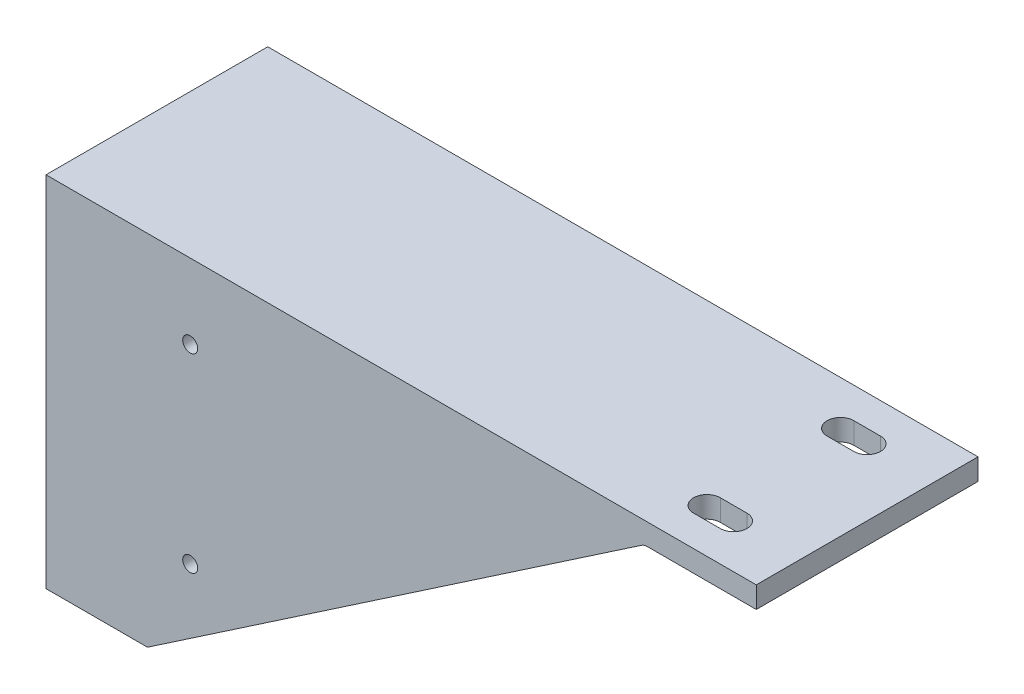
from build123d import *

# Parameters (mm, degrees)
SKETCH1_W                        = 42.5704
SKETCH1_H                        = 75.0824
TOUCHESLEFTSIDE_DEPTH            = 5.08
SKETCH2_W                        = 52.7304
SKETCH2_H                        = 85.2424
SKETCH2_W_2                      = 42.5704
SKETCH2_H_2                      = 75.0824
ENCLOSES_DEPTH                   = 24.13
SKETCH11_W                       = 14.478
SKETCH11_H                       = 29.1084
WIREGAP_DEPTH                    = 5.08
SKETCH6_W                        = 144.78
SKETCH6_H                        = 52.7304
HORIZONTAL_DEPTH                 = 5.08
UPPERDIAGONAL_DEPTH              = 5.08
LOWERDIAGONAL_DEPTH              = 5.08
F_10_START                       = 75.0824
F_10_0_1935_DIAMETER_SLOT1_DEPTH = 5.08
FILLET1_R                        = 2.54
CROSSBEAMSUPPORTHOLES_DEPTH      = 178.945286698
CROSSBEAMSUPPORTHOLES_DEPTH_BACK = 178.945286698
SKETCH12_R                       = 1.778
NUTEMPLACEMENTS1_DEPTH           = 2.54
NUTEMPLACEMENTS2_DEPTH           = 2.54


# Read off the part's stored shape, not the designer's step: #10 (0.1935) Diameter Slot1
with BuildPart() as part:
    # Sketch1 → TouchesLeftSide (new body)
    with BuildSketch(Plane(origin=(0, 0, 0), x_dir=(0, 0, -1), z_dir=(1, 0, 0))):
        with Locations((-21.2852, 37.5412)):
            Rectangle(SKETCH1_W, SKETCH1_H)
    extrude(amount=TOUCHESLEFTSIDE_DEPTH)

    # Sketch2 → Encloses (add)
    with BuildSketch(Plane(origin=(5.08, 0, 0), x_dir=(0, 0, -1), z_dir=(1, 0, 0))):
        with Locations((-21.2852, 37.5412)):
            Rectangle(SKETCH2_W, SKETCH2_H)
        with Locations((-21.2852, 37.5412)):
            Rectangle(SKETCH2_W_2, SKETCH2_H_2, mode=Mode.SUBTRACT)
    extrude(amount=-ENCLOSES_DEPTH)

    # Sketch11 → WireGap (cut)
    with BuildSketch(Plane(origin=(0, 0, 0), x_dir=(1, 0, 0), z_dir=(0, 1, 0))):
        with Locations((-11.811, -19.6342)):
            Rectangle(SKETCH11_W, SKETCH11_H)
    extrude(amount=-WIREGAP_DEPTH, mode=Mode.SUBTRACT)

    # Sketch6 → Horizontal (add)
    with BuildSketch(Plane(origin=(0, 80.1624, 0), x_dir=(1, 0, 0), z_dir=(0, 1, 0))):
        with Locations((77.47, -21.2852)):
            Rectangle(SKETCH6_W, SKETCH6_H)
    extrude(amount=-HORIZONTAL_DEPTH)

    # Sketch7 → UpperDiagonal (add)
    with BuildSketch(Plane.XY.offset(47.6504)):
        Polygon((5.08, -5.08), (5.08, 75.0824), (123.19, 75.0824), align=None)
    extrude(amount=-UPPERDIAGONAL_DEPTH)

    # Sketch8 → LowerDiagonal (add)
    with BuildSketch(Plane(origin=(0, 0, -5.08), x_dir=(-1, 0, 0), z_dir=(0, 0, -1))):
        Polygon((-5.08, -5.08), (-5.08, 75.0824), (-123.19, 75.0824), align=None)
    extrude(amount=-LOWERDIAGONAL_DEPTH)

    # #10 (0.1935) Diameter Slot1 outline → #10 (0.1935) Diameter Slot1 (cut)
    with BuildSketch(Plane(origin=(0, 0, 0), x_dir=(1, 0, 0), z_dir=(0, 1, 0)).offset(F_10_START)):
        with BuildLine():
            Line((127.635, -8.5852), (133.985, -8.5852))
            ThreePointArc((133.985, -8.5852), (137.16, -5.4102), (133.985, -2.2352))
            Line((133.985, -2.2352), (127.635, -2.2352))
            ThreePointArc((127.635, -2.2352), (124.46, -5.4102), (127.635, -8.5852))
        make_face()
        with BuildLine():
            Line((127.635, -40.3352), (133.985, -40.3352))
            ThreePointArc((133.985, -40.3352), (137.16, -37.1602), (133.985, -33.9852))
            Line((133.985, -33.9852), (127.635, -33.9852))
            ThreePointArc((127.635, -33.9852), (124.46, -37.1602), (127.635, -40.3352))
        make_face()
    extrude(amount=F_10_0_1935_DIAMETER_SLOT1_DEPTH, mode=Mode.SUBTRACT)

    # Fillet1
    fillet1_edges = [part.edges().sort_by_distance(p)[0] for p in [
        (123.19, 75.0824, 45.1104),
        (5.08, 35.0012, 42.5704),
        (64.135, 75.0824, 42.5704),
        (5.08, 75.0824, 21.2852),
        (64.135, 75.0824, 0),
        (123.19, 75.0824, -2.54),
        (5.08, 35.0012, 0),
    ]]
    fillet(fillet1_edges, radius=FILLET1_R)

    # Sketch12 → CrossbeamSupportHoles (cut, two sides: drawn at the far end of the back side and taken through both)
    with BuildSketch(Plane.XY.offset(47.6504).offset(-CROSSBEAMSUPPORTHOLES_DEPTH_BACK)):
        with Locations((15.24, 17.164557597)):
            Circle(SKETCH12_R)
        with Locations((15.24, 62.3824)):
            Circle(SKETCH12_R)
    extrude(amount=CROSSBEAMSUPPORTHOLES_DEPTH + CROSSBEAMSUPPORTHOLES_DEPTH_BACK, mode=Mode.SUBTRACT)

    # Sketch13 → NutEmplacements1 (cut)
    with BuildSketch(Plane(origin=(0, 0, 42.5704), x_dir=(-1, 0, 0), z_dir=(0, 0, -1))):
        Polygon((-19.304, 14.818206103), (-15.24, 12.471854609), (-11.176, 14.818206103), (-11.176, 19.510909091), (-15.24, 21.857260585), (-19.304, 19.510909091), align=None)
        Polygon((-15.24, 57.689697012), (-11.176, 60.036048506), (-11.176, 64.728751494), (-15.24, 67.075102988), (-19.304, 64.728751494), (-19.304, 60.036048506), align=None)
    extrude(amount=-NUTEMPLACEMENTS1_DEPTH, mode=Mode.SUBTRACT)

    # Sketch14 → NutEmplacements2 (cut)
    with BuildSketch(Plane.XY):
        Polygon((15.24, 21.857260585), (11.176, 19.510909091), (11.176, 14.818206103), (15.24, 12.471854609), (19.304, 14.818206103), (19.304, 19.510909091), align=None)
        Polygon((15.24, 57.689697012), (19.304, 60.036048506), (19.304, 64.728751494), (15.24, 67.075102988), (11.176, 64.728751494), (11.176, 60.036048506), align=None)
    extrude(amount=-NUTEMPLACEMENTS2_DEPTH, mode=Mode.SUBTRACT)


solid = part.part
